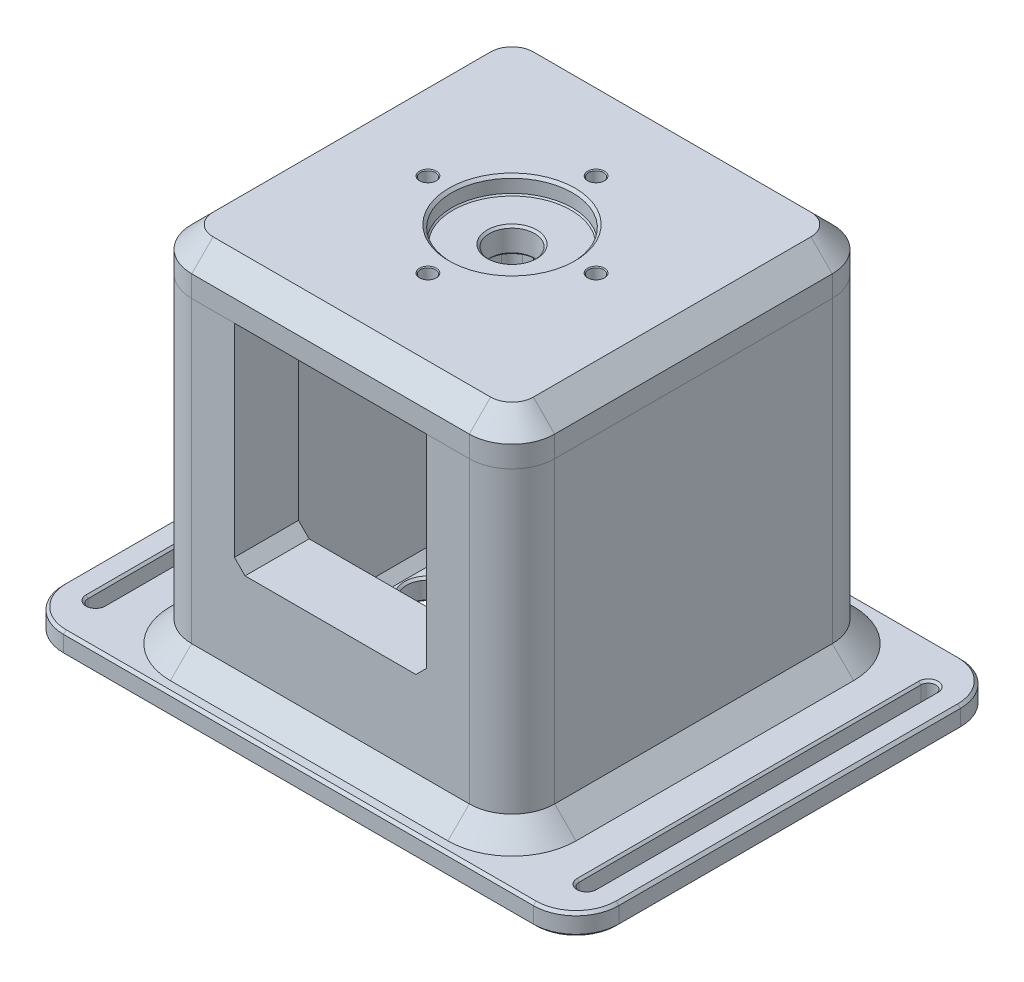
from build123d import *

# Parameters (mm, degrees)
SKETCH1_W                     = 165.1
SKETCH1_H                     = 127
BOSS_EXTRUDE1_DEPTH           = 6.35
SKETCH2_W                     = 57.15
SKETCH2_H                     = 19.05
BOSS_EXTRUDE2_DEPTH           = 38.1
BOSS_EXTRUDE3_DEPTH           = 101.6
BOSS_EXTRUDE4_START           = 101.6
SKETCH2_4_W                   = 57.15
SKETCH2_4_H                   = 19.05
SKETCH2_4_W_2                 = 69.85
SKETCH2_4_H_2                 = 69.85
BOSS_EXTRUDE4_DEPTH           = 12.7
CUT_EXTRUDE1_DEPTH            = 155.632604906
CUT_EXTRUDE1_DEPTH_BACK       = 5.08
SKETCH7_R                     = 17.9578
F_8_START                     = -50.8
F_8_CLEARANCE_SLOT1_2_DEPTH   = 101.6
CIRPATTERN1_COUNT             = 4
F_3_8_START                   = 25.4
F_3_8_CLEARANCE_SLOT1_2_DEPTH = 12.7
FILLET2_R                     = 3.175
FILLET1_R                     = 12.7
CHAMFER1_SIZE                 = 2.54
CHAMFER8_SIZE                 = 6.35
CHAMFER2_SIZE                 = 6.35
CHAMFER9_SIZE                 = 3.175
CHAMFER3_SIZE                 = 0.79375
CHAMFER5_SIZE                 = 0.79375
CHAMFER6_SIZE                 = 0.396875


with BuildPart() as part:
    # Sketch1 → Boss-Extrude1 (new body)
    with BuildSketch(Plane(origin=(0, 0, 0), x_dir=(1, 0, 0), z_dir=(0, 1, 0))):
        Rectangle(SKETCH1_W, SKETCH1_H)
    extrude(amount=BOSS_EXTRUDE1_DEPTH)

    # Sketch2 → Boss-Extrude2 (add)
    with BuildSketch(Plane(origin=(0, 0, 0), x_dir=(1, 0, 0), z_dir=(0, 1, 0))):
        Polygon((-28.575, 53.975), (-53.975, 53.975), (-53.975, -53.975), (-28.575, -53.975), (-28.575, -34.925), (-34.925, -34.925), (-34.925, 34.925), (-28.575, 34.925), align=None)
        with Locations((0, 44.45)):
            Rectangle(SKETCH2_W, SKETCH2_H)
        Polygon((53.975, 53.975), (28.575, 53.975), (28.575, 34.925), (34.925, 34.925), (34.925, -34.925), (28.575, -34.925), (28.575, -53.975), (53.975, -53.975), align=None)
        with Locations((0, -44.45)):
            Rectangle(SKETCH2_W, SKETCH2_H)
    extrude(amount=BOSS_EXTRUDE2_DEPTH)

    # Sketch2<3> → Boss-Extrude3 (add)
    with BuildSketch(Plane(origin=(0, 0, 0), x_dir=(1, 0, 0), z_dir=(0, 1, 0))):
        Polygon((-28.575, 53.975), (-53.975, 53.975), (-53.975, -53.975), (-28.575, -53.975), (-28.575, -34.925), (-34.925, -34.925), (-34.925, 34.925), (-28.575, 34.925), align=None)
        Polygon((53.975, 53.975), (28.575, 53.975), (28.575, 34.925), (34.925, 34.925), (34.925, -34.925), (28.575, -34.925), (28.575, -53.975), (53.975, -53.975), align=None)
    extrude(amount=BOSS_EXTRUDE3_DEPTH)

    # Sketch2<4> → Boss-Extrude4 (add)
    with BuildSketch(Plane(origin=(0, 0, 0), x_dir=(1, 0, 0), z_dir=(0, 1, 0)).offset(BOSS_EXTRUDE4_START)):
        with Locations((0, 44.45)):
            Rectangle(SKETCH2_4_W, SKETCH2_4_H)
        Polygon((-28.575, 53.975), (-53.975, 53.975), (-53.975, -53.975), (-28.575, -53.975), (-28.575, -34.925), (-34.925, -34.925), (-34.925, 34.925), (-28.575, 34.925), align=None)
        with Locations((0, -44.45)):
            Rectangle(SKETCH2_4_W, SKETCH2_4_H)
        Polygon((53.975, 53.975), (28.575, 53.975), (28.575, 34.925), (34.925, 34.925), (34.925, -34.925), (28.575, -34.925), (28.575, -53.975), (53.975, -53.975), align=None)
        Rectangle(SKETCH2_4_W_2, SKETCH2_4_H_2)
    extrude(amount=BOSS_EXTRUDE4_DEPTH)

    # Sketch7 → Cut-Extrude1 (cut, two sides: drawn at the far end of the back side and taken through both)
    with BuildSketch(Plane(origin=(0, 114.3, 0), x_dir=(1, 0, 0), z_dir=(0, 1, 0)).offset(-CUT_EXTRUDE1_DEPTH_BACK)):
        with Locations(Location((0, 0, 0), (0, 0, 90))):
            Circle(SKETCH7_R)
    extrude(amount=CUT_EXTRUDE1_DEPTH + CUT_EXTRUDE1_DEPTH_BACK, mode=Mode.SUBTRACT)

    # Sketch19 → 1/2 Clearance Hole1 (revolve, cut)
    with BuildSketch(Plane(origin=(0, 109.22, 0), x_dir=(0, 0, 1), z_dir=(1, 0, 0))):
        Polygon((0, 0), (0, 7.62), (7.38124, 7.62), (6.74624, 6.985), (6.74624, 0.635), (7.38124, 0), align=None)
    revolve(axis=Axis((0, 115.57, 0), (0, -1, 0)), mode=Mode.SUBTRACT)

    # #8 Clearance Slot1: read off the stored shape, not the designer's step
    # #8 Clearance Slot1 outline → #8 Clearance Slot1 (revolve, cut)
    with BuildSketch(Plane(origin=(73.025, 0, -50.8), x_dir=(1, 0, 0), z_dir=(0, 0, 1))):
        Polygon((0, 0), (2.8829, 0), (2.2479, 0.635), (2.2479, 5.715), (2.8829, 6.35), (0, 6.35), align=None)
    revolve(axis=Axis((73.025, 0, -50.8), (0, 1, 0)), mode=Mode.SUBTRACT)

    # 8 Clearance Slot1 2 outline → 8 Clearance Slot1 2 (cut)
    with BuildSketch(Plane.XY.offset(F_8_START)):
        Polygon((75.9079, 6.35), (70.1421, 6.35), (70.7771, 5.715), (70.7771, 0.635), (70.1421, 0), (75.9079, 0), (75.2729, 0.635), (75.2729, 5.715), align=None)
        Polygon((-70.7771, 5.715), (-70.1421, 6.35), (-75.9079, 6.35), (-75.2729, 5.715), (-75.2729, 0.635), (-75.9079, 0), (-70.1421, 0), (-70.7771, 0.635), align=None)
    extrude(amount=F_8_CLEARANCE_SLOT1_2_DEPTH, mode=Mode.SUBTRACT)

    # 8 Clearance Slot1 3 outline → 8 Clearance Slot1 3 (revolve, cut)
    with BuildSketch(Plane(origin=(73.025, 0, 50.8), x_dir=(1, 0, 0), z_dir=(0, 0, 1))):
        Polygon((0, 0), (2.8829, 0), (2.2479, 0.635), (2.2479, 5.715), (2.8829, 6.35), (0, 6.35), align=None)
    revolve(axis=Axis((73.025, 0, 50.8), (0, 1, 0)), mode=Mode.SUBTRACT)

    # 8 Clearance Slot1 4 outline → 8 Clearance Slot1 4 (revolve, cut)
    with BuildSketch(Plane(origin=(-73.025, 0, -50.8), x_dir=(1, 0, 0), z_dir=(0, 0, 1))):
        Polygon((0, 0), (2.8829, 0), (2.2479, 0.635), (2.2479, 5.715), (2.8829, 6.35), (0, 6.35), align=None)
    revolve(axis=Axis((-73.025, 0, -50.8), (0, 1, 0)), mode=Mode.SUBTRACT)

    # 8 Clearance Slot1 5 outline → 8 Clearance Slot1 5 (revolve, cut)
    with BuildSketch(Plane(origin=(-73.025, 0, 50.8), x_dir=(1, 0, 0), z_dir=(0, 0, 1))):
        Polygon((0, 0), (2.8829, 0), (2.2479, 0.635), (2.2479, 5.715), (2.8829, 6.35), (0, 6.35), align=None)
    revolve(axis=Axis((-73.025, 0, 50.8), (0, 1, 0)), mode=Mode.SUBTRACT)

    # Sketch11 → 1/2 (0.5) Diameter Hole1 (revolve, cut)
    with BuildSketch(Plane(origin=(25, 0, 0), x_dir=(0, 0, -1), z_dir=(1, 0, 0))):
        Polygon((0, 0), (0, 6.35), (6.985, 6.35), (6.35, 5.715), (6.35, 0.635), (6.985, 0), align=None)
    f_1_2_0_5_diameter_hole1 = revolve(axis=Axis((25, -6.35, 0), (0, 1, 0)), mode=Mode.SUBTRACT)

    # Sketch13 → #8 Clearance Hole2 (revolve, cut)
    with BuildSketch(Plane(origin=(25, 101.6, 0), x_dir=(0, 0, -1), z_dir=(1, 0, 0))):
        Polygon((0, 0), (0, 12.7), (2.5019, 12.7), (2.2479, 12.446), (2.2479, 0.635), (2.8829, 0), align=None)
    f_8_clearance_hole2 = revolve(axis=Axis((25, 95.25, 0), (0, 1, 0)), mode=Mode.SUBTRACT)

    # CirPattern1: 1/2 (0.5) Diameter Hole1, #8 Clearance Hole2 ×4 about axis
    cirpattern1_axis = Axis((0, 0, 0), (0, 1, 0))
    add([f_1_2_0_5_diameter_hole1.rotate(cirpattern1_axis, i * 360 / CIRPATTERN1_COUNT) for i in range(1, CIRPATTERN1_COUNT)], mode=Mode.SUBTRACT)
    add([f_8_clearance_hole2.rotate(cirpattern1_axis, i * 360 / CIRPATTERN1_COUNT) for i in range(1, CIRPATTERN1_COUNT)], mode=Mode.SUBTRACT)

    # 3/8 Clearance Slot1: read off the stored shape, not the designer's step
    # 3/8 Clearance Slot1 outline → 3/8 Clearance Slot1 (revolve, cut)
    with BuildSketch(Plane.XZ.offset(-25.4)):
        Polygon((5.5372, -34.925), (0, -34.925), (0, -53.975), (5.5372, -53.975), (4.9022, -53.34), (4.9022, -35.56), align=None)
    revolve(axis=Axis((0, 25.4, 0), (0, 0, 1)), mode=Mode.SUBTRACT)

    # 3_8 Clearance Slot1 2 outline → 3_8 Clearance Slot1 2 (cut)
    with BuildSketch(Plane(origin=(0, 0, 0), x_dir=(1, 0, 0), z_dir=(0, 1, 0)).offset(F_3_8_START)):
        Polygon((4.9022, 53.34), (5.5372, 53.975), (-5.5372, 53.975), (-4.9022, 53.34), (-4.9022, 35.56), (-5.5372, 34.925), (5.5372, 34.925), (4.9022, 35.56), align=None)
    extrude(amount=F_3_8_CLEARANCE_SLOT1_2_DEPTH, mode=Mode.SUBTRACT)

    # Fillet2
    fillet2_edges = [part.edges().sort_by_distance(p)[0] for p in [
        (-34.925, 53.975, -34.925),
        (34.925, 53.975, -34.925),
        (34.925, 53.975, 34.925),
        (-34.925, 53.975, 34.925),
    ]]
    fillet(fillet2_edges, radius=FILLET2_R)

    # Fillet1
    fillet1_edges = [part.edges().sort_by_distance(p)[0] for p in [
        (53.975, 60.325, 53.975),
        (53.975, 60.325, -53.975),
        (-53.975, 60.325, -53.975),
        (-53.975, 60.325, 53.975),
        (82.55, 3.175, 63.5),
        (-82.55, 3.175, 63.5),
        (-82.55, 3.175, -63.5),
        (82.55, 3.175, -63.5),
    ]]
    fillet(fillet1_edges, radius=FILLET1_R)

    # Chamfer1
    chamfer1_edges = [part.edges().sort_by_distance(p)[0] for p in [
        (0, 6.35, -34.925),
        (-34.925, 6.35, 0),
        (0, 6.35, 34.925),
        (34.925, 6.35, 0),
        (33.99506403, 6.35, 33.99506403),
        (-33.99506403, 6.35, 33.99506403),
        (33.99506403, 6.35, -33.99506403),
        (-33.99506403, 6.35, -33.99506403),
    ]]
    chamfer(chamfer1_edges, length=CHAMFER1_SIZE)

    # Chamfer8
    chamfer8_edges = [part.edges().sort_by_distance(p)[0] for p in [
        (53.975, 6.35, 0),
        (0, 6.35, 53.975),
        (-53.975, 6.35, 0),
        (0, 6.35, -53.975),
        (-50.255256121, 6.35, -50.255256121),
        (50.255256121, 6.35, -50.255256121),
        (50.255256121, 6.35, 50.255256121),
        (-50.255256121, 6.35, 50.255256121),
    ]]
    chamfer(chamfer8_edges, length=CHAMFER8_SIZE)

    # Chamfer2
    chamfer2_edges = [part.edges().sort_by_distance(p)[0] for p in [
        (-53.975, 114.3, 0),
        (0, 114.3, -53.975),
        (0, 114.3, 53.975),
        (53.975, 114.3, 0),
        (-50.255256121, 114.3, 50.255256121),
        (50.255256121, 114.3, 50.255256121),
        (50.255256121, 114.3, -50.255256121),
        (-50.255256121, 114.3, -50.255256121),
    ]]
    chamfer(chamfer2_edges, length=CHAMFER2_SIZE)

    # Chamfer9
    chamfer9_edges = [part.edges().sort_by_distance(p)[0] for p in [
        (28.575, 38.1, -44.45),
        (28.575, 38.1, 44.45),
        (-4.9022, 38.1, -44.45),
        (4.9022, 38.1, -44.45),
        (-28.575, 38.1, 44.45),
        (-28.575, 38.1, -44.45),
    ]]
    chamfer(chamfer9_edges, length=CHAMFER9_SIZE)

    # Chamfer3
    chamfer3_edges = [part.edges().sort_by_distance(p)[0] for p in [
        (0, 0, -63.5),
        (0, 6.35, -63.5),
        (82.55, 0, 0),
        (0, 0, 63.5),
        (-82.55, 0, 0),
        (78.830256121, 0, 59.780256121),
        (-78.830256121, 0, 59.780256121),
        (-78.830256121, 0, -59.780256121),
        (78.830256121, 0, -59.780256121),
        (82.55, 6.35, 0),
        (-82.55, 6.35, 0),
        (0, 6.35, 63.5),
        (78.830256121, 6.35, 59.780256121),
        (-78.830256121, 6.35, 59.780256121),
        (-78.830256121, 6.35, -59.780256121),
        (78.830256121, 6.35, -59.780256121),
    ]]
    chamfer(chamfer3_edges, length=CHAMFER3_SIZE)

    # Chamfer5
    chamfer5_edges = [part.edges().sort_by_distance(p)[0] for p in [
        (0, 114.3, 17.9578),
    ]]
    chamfer(chamfer5_edges, length=CHAMFER5_SIZE)

    # Chamfer6
    chamfer6_edges = [part.edges().sort_by_distance(p)[0] for p in [
        (0, 109.22, 17.9578),
    ]]
    chamfer(chamfer6_edges, length=CHAMFER6_SIZE)


with BuildPart() as body_2:
    # Split1: the piece on the far side of the plane
    add(part.part)
    split(bisect_by=Plane.ZX.offset(101.6), keep=Keep.BOTTOM)


with BuildPart() as part_1:
    add(part.part)

    # Split1
    split(bisect_by=Plane.ZX.offset(101.6), keep=Keep.TOP)


solid = Compound([body_2.part, part_1.part])
